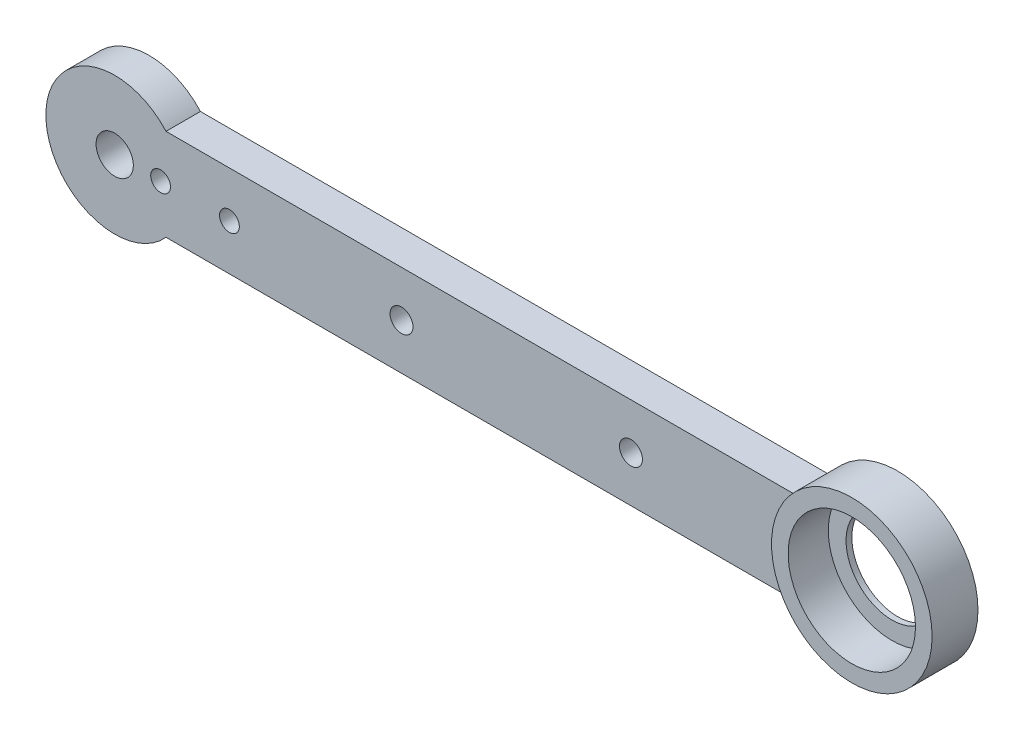
from build123d import *
from build123d.topology import SkipClean

# Parameters (mm, degrees)
BOSS_EXTRUDE1_START     = 3
SKETCH1_W               = 130
SKETCH1_H               = 16
BOSS_EXTRUDE1_DEPTH     = 6
BOSS_EXTRUDE2_START     = 3
SKETCH2_R               = 12
BOSS_EXTRUDE2_DEPTH     = 6
BOSS_EXTRUDE3_START     = 3
SKETCH3_R               = 14
BOSS_EXTRUDE3_DEPTH     = 6
BOSS_EXTRUDE4_START     = 2.5
SKETCH4_R               = 14
BOSS_EXTRUDE4_DEPTH     = 8
CUT_EXTRUDE1_DEPTH      = 146.059470563
CUT_EXTRUDE1_DEPTH_BACK = 146.059470563
SKETCH5_R               = 3.25
CUT_EXTRUDE2_DEPTH      = 146.059470563
CUT_EXTRUDE2_DEPTH_BACK = 146.059470563
SKETCH6_R               = 1.725
CUT_EXTRUDE3_START      = 3
SKETCH7_R               = 2.9
CUT_EXTRUDE3_DEPTH      = 2.2
CUT_EXTRUDE4_START      = 3
SKETCH8_R               = 2.9
CUT_EXTRUDE4_DEPTH      = 2.2
CUT_EXTRUDE5_START      = 3.5
SKETCH9_R               = 11.1
CUT_EXTRUDE5_DEPTH      = 7
CUT_EXTRUDE6_DEPTH      = 146.059470563
CUT_EXTRUDE6_DEPTH_BACK = 146.059470563
SKETCH10_R              = 8
CUT_EXTRUDE7_START      = 5
SKETCH11_R              = 2
CUT_EXTRUDE7_DEPTH      = 4


with BuildPart() as part:
    # Sketch1 → Boss-Extrude1 (new body)
    with BuildSketch(Plane.XY.offset(BOSS_EXTRUDE1_START)):
        with Locations((65, 0)):
            Rectangle(SKETCH1_W, SKETCH1_H)
    extrude(amount=BOSS_EXTRUDE1_DEPTH)

    # Sketch2 → Boss-Extrude2 (add)
    with BuildSketch(Plane.XY.offset(BOSS_EXTRUDE2_START)):
        Circle(SKETCH2_R)
    extrude(amount=BOSS_EXTRUDE2_DEPTH)

    # Sketch3 → Boss-Extrude3 (add)
    with BuildSketch(Plane.XY.offset(BOSS_EXTRUDE3_START)):
        with Locations((130, 0)):
            Circle(SKETCH3_R)
    extrude(amount=BOSS_EXTRUDE3_DEPTH)

    # Sketch4 → Boss-Extrude4 (add)
    with SkipClean():  # the faces are left unmerged after this step: merging them gives an invalid solid
        with BuildSketch(Plane.XY.offset(BOSS_EXTRUDE4_START)):
            with Locations((130, 0)):
                Circle(SKETCH4_R)
        extrude(amount=BOSS_EXTRUDE4_DEPTH)
    add(part.part.scale(1), mode=Mode.REPLACE)  # the faces are merged on a copy

    # Sketch5 → Cut-Extrude1 (cut, two sides: drawn at the far end of the back side and taken through both)
    with BuildSketch(Plane.XY.offset(-CUT_EXTRUDE1_DEPTH_BACK)):
        Circle(SKETCH5_R)
    extrude(amount=CUT_EXTRUDE1_DEPTH + CUT_EXTRUDE1_DEPTH_BACK, mode=Mode.SUBTRACT)

    # Sketch6 → Cut-Extrude2 (cut, two sides: drawn at the far end of the back side and taken through both)
    with BuildSketch(Plane.XY.offset(-CUT_EXTRUDE2_DEPTH_BACK)):
        with Locations((8, 0)):
            Circle(SKETCH6_R)
        with Locations((20, 0)):
            Circle(SKETCH6_R)
    extrude(amount=CUT_EXTRUDE2_DEPTH + CUT_EXTRUDE2_DEPTH_BACK, mode=Mode.SUBTRACT)

    # Sketch7 → Cut-Extrude3 (cut)
    with BuildSketch(Plane.XY.offset(CUT_EXTRUDE3_START)):
        with Locations((8, 0)):
            Circle(SKETCH7_R)
    extrude(amount=CUT_EXTRUDE3_DEPTH, mode=Mode.SUBTRACT)

    # Sketch8 → Cut-Extrude4 (cut)
    with BuildSketch(Plane.XY.offset(CUT_EXTRUDE4_START)):
        with Locations((20, 0)):
            Circle(SKETCH8_R)
    extrude(amount=CUT_EXTRUDE4_DEPTH, mode=Mode.SUBTRACT)

    # Sketch9 → Cut-Extrude5 (cut)
    with BuildSketch(Plane.XY.offset(CUT_EXTRUDE5_START)):
        with Locations((130, 0)):
            Circle(SKETCH9_R)
    extrude(amount=CUT_EXTRUDE5_DEPTH, mode=Mode.SUBTRACT)

    # Sketch10 → Cut-Extrude6 (cut, two sides: drawn at the far end of the back side and taken through both)
    with BuildSketch(Plane.XY.offset(-CUT_EXTRUDE6_DEPTH_BACK)):
        with Locations((130, 0)):
            Circle(SKETCH10_R)
    extrude(amount=CUT_EXTRUDE6_DEPTH + CUT_EXTRUDE6_DEPTH_BACK, mode=Mode.SUBTRACT)

    # Sketch11 → Cut-Extrude7 (cut)
    with BuildSketch(Plane.XY.offset(CUT_EXTRUDE7_START)):
        with Locations((50, 0)):
            Circle(SKETCH11_R)
        with Locations((90, 0)):
            Circle(SKETCH11_R)
    extrude(amount=CUT_EXTRUDE7_DEPTH, mode=Mode.SUBTRACT)


solid = part.part
